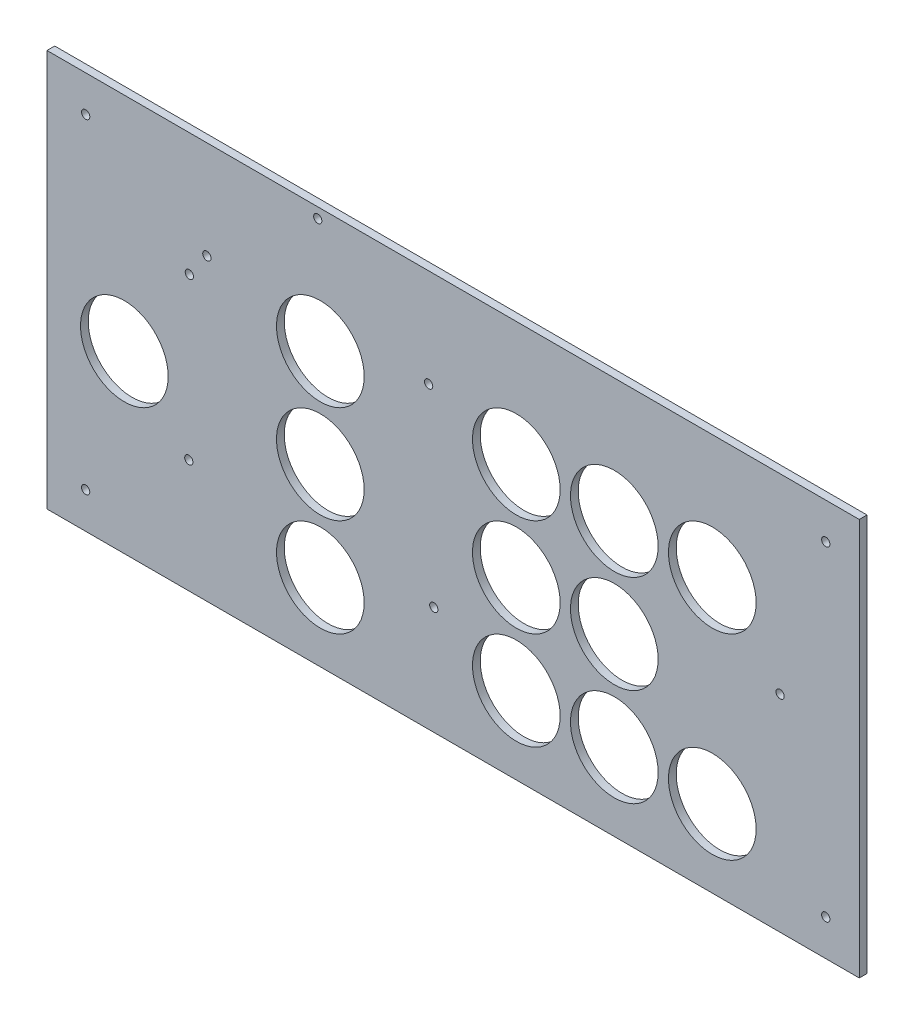
from build123d import *

# Parameters (mm, degrees)
SKETCH_1_W      = 315
SKETCH_1_H      = 154
SKETCH_1_R      = 1.6
SKETCH_1_R_2    = 17
EXTRUDE_1_DEPTH = 1.5


with BuildPart() as part:
    # 草图1 → 凸台-拉伸1 (new, symmetric)
    with BuildSketch(Plane.XY):
        with Locations((7.5, 35)):
            Rectangle(SKETCH_1_W, SKETCH_1_H)
        Circle(SKETCH_1_R, mode=Mode.SUBTRACT)
        with Locations((-94.8, 64.4)):
            Circle(SKETCH_1_R, mode=Mode.SUBTRACT)
        with Locations((134.3, 38)):
            Circle(SKETCH_1_R, mode=Mode.SUBTRACT)
        with Locations((-95, 2)):
            Circle(SKETCH_1_R, mode=Mode.SUBTRACT)
        with Locations((-88, 74)):
            Circle(SKETCH_1_R, mode=Mode.SUBTRACT)
        with Locations((-2, 74)):
            Circle(SKETCH_1_R, mode=Mode.SUBTRACT)
        with Locations((-45, 108)):
            Circle(SKETCH_1_R, mode=Mode.SUBTRACT)
        with Locations((-135, -28)):
            Circle(SKETCH_1_R, mode=Mode.SUBTRACT)
        with Locations((152, -28)):
            Circle(SKETCH_1_R, mode=Mode.SUBTRACT)
        with Locations((-135, 98)):
            Circle(SKETCH_1_R, mode=Mode.SUBTRACT)
        with Locations((152, 98)):
            Circle(SKETCH_1_R, mode=Mode.SUBTRACT)
        with Locations((-120, 26)):
            Circle(SKETCH_1_R_2, mode=Mode.SUBTRACT)
        with Locations((-44, -12)):
            Circle(SKETCH_1_R_2, mode=Mode.SUBTRACT)
        with Locations((-44, 26)):
            Circle(SKETCH_1_R_2, mode=Mode.SUBTRACT)
        with Locations((-44, 64)):
            Circle(SKETCH_1_R_2, mode=Mode.SUBTRACT)
        with Locations((32, -12)):
            Circle(SKETCH_1_R_2, mode=Mode.SUBTRACT)
        with Locations((32, 26)):
            Circle(SKETCH_1_R_2, mode=Mode.SUBTRACT)
        with Locations((32, 64)):
            Circle(SKETCH_1_R_2, mode=Mode.SUBTRACT)
        with Locations((70, -12)):
            Circle(SKETCH_1_R_2, mode=Mode.SUBTRACT)
        with Locations((70, 26)):
            Circle(SKETCH_1_R_2, mode=Mode.SUBTRACT)
        with Locations((70, 64)):
            Circle(SKETCH_1_R_2, mode=Mode.SUBTRACT)
        with Locations((108, -12)):
            Circle(SKETCH_1_R_2, mode=Mode.SUBTRACT)
        with Locations((108, 64)):
            Circle(SKETCH_1_R_2, mode=Mode.SUBTRACT)
    extrude(amount=EXTRUDE_1_DEPTH, both=True)


solid = part.part
